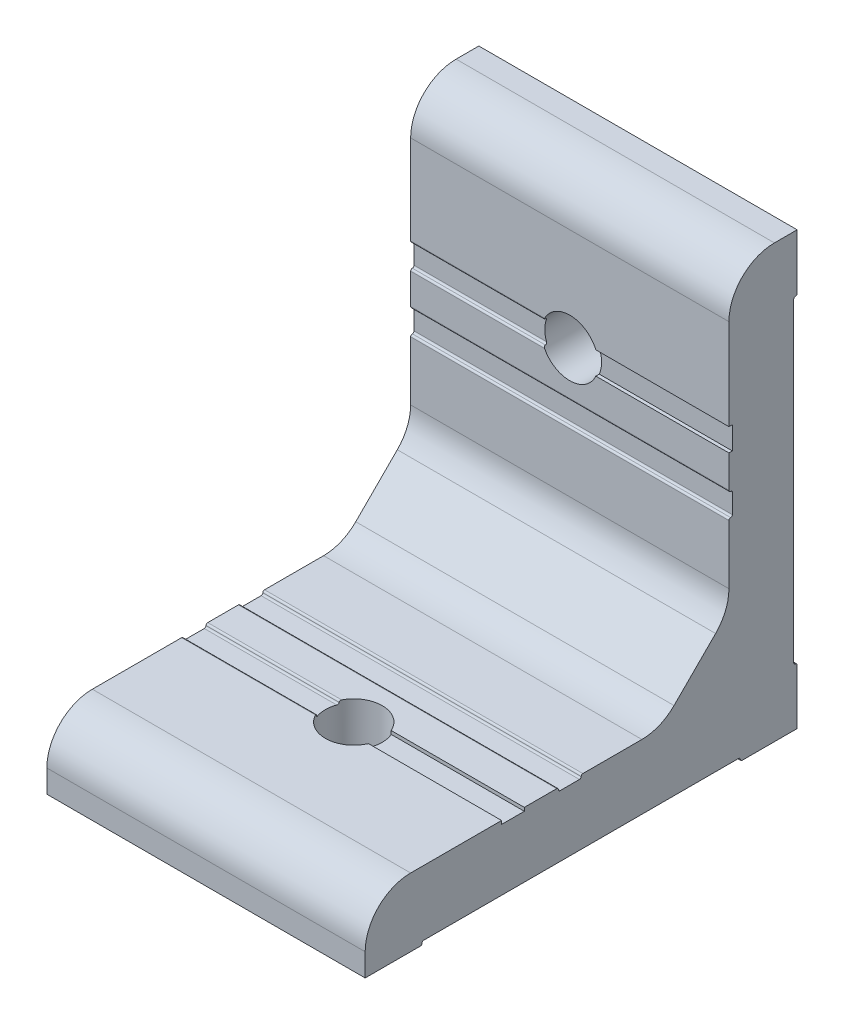
from build123d import *

# Parameters (mm, degrees)
ESBO_O1_W                  = 38
ESBO_O1_H                  = 38
RESSALTO_EXTRUS_O1_DEPTH   = 28
CORTE_EXTRUS_O1_DEPTH      = 57.471231614
ESBO_O7_W                  = 0.3
ESBO_O7_H                  = 28
ESBO_O7_W_2                = 28
ESBO_O7_H_2                = 0.3
ESBO_O7_W_3                = 2
ESBO_O7_H_3                = 2
CORTE_EXTRUS_O2_DEPTH      = 57.471231614
FURO_DE_DI_METRO_7_0_7_3_D = 5
FURO_DE_DI_METRO_7_0_7_2_D = 5
FILETE1_R                  = 4
FILETE2_R                  = 0.15


with BuildPart() as part:
    # Esboço1 → Ressalto-extrusão1 (new body)
    with BuildSketch(Plane(origin=(10, 0, 0), x_dir=(0, 0, -1), z_dir=(1, 0, 0))):
        with Locations((-12, 19)):
            Rectangle(ESBO_O1_W, ESBO_O1_H)
    extrude(amount=-RESSALTO_EXTRUS_O1_DEPTH)

    # Esboço2 → Corte-extrusão1 (cut, through all)
    with BuildSketch(Plane.ZY.offset(18)):
        Polygon((31, 38), (-1, 38), (-1, 12), (5, 6), (31, 6), align=None)
    extrude(amount=-CORTE_EXTRUS_O1_DEPTH, mode=Mode.SUBTRACT)

    # Esboço7 → Corte-extrusão2 (cut, through all)
    with BuildSketch(Plane(origin=(10, 0, 0), x_dir=(0, 0, -1), z_dir=(1, 0, 0))):
        with Locations((6.85, 19)):
            Rectangle(ESBO_O7_W, ESBO_O7_H)
        with Locations((-12, 0.15)):
            Rectangle(ESBO_O7_W_2, ESBO_O7_H_2)
        with Locations((-13, 5.85)):
            Rectangle(ESBO_O7_W_3, ESBO_O7_H_2)
        with Locations((1.15, 20)):
            Rectangle(ESBO_O7_W, ESBO_O7_H_3)
        with Locations((-18, 5.85)):
            Rectangle(ESBO_O7_W_3, ESBO_O7_H_2)
        with Locations((1.15, 25)):
            Rectangle(ESBO_O7_W, ESBO_O7_H_3)
    extrude(amount=-CORTE_EXTRUS_O2_DEPTH, mode=Mode.SUBTRACT)

    # Furo de diâmetro Ø7.0 (7)3 (through all)
    with Locations(Plane(origin=(0, 6, 0), x_dir=(1, 0, 0), z_dir=(0, 1, 0))):
        with Locations((-4, -18)):
            Hole(FURO_DE_DI_METRO_7_0_7_3_D / 2)

    # Furo de diâmetro Ø7.0 (7)2 (through all)
    with Locations(Plane(origin=(0, 0, -7), x_dir=(-1, 0, 0), z_dir=(0, 0, -1))):
        with Locations((4, 25)):
            Hole(FURO_DE_DI_METRO_7_0_7_2_D / 2)

    # Filete1
    filete1_edges = [part.edges().sort_by_distance(p)[0] for p in [
        (-4, 6, 31),
        (-4, 6, 5),
        (-4, 12, -1),
        (-4, 38, -1),
    ]]
    fillet(filete1_edges, radius=FILETE1_R)

    # Filete2
    filete2_edges = [part.edges().sort_by_distance(p)[0] for p in [
        (-4, 5, -7),
        (-4, 5, -6.7),
        (-4, 33, -7),
        (-4, 33, -6.7),
        (-4, 0, 26),
        (-4, 0.3, 26),
        (-4, 0.3, -2),
        (-4, 0, -2),
        (-4, 19, -1.3),
        (-4, 19, -1),
        (-4, 21, -1.3),
        (-4, 21, -1),
        (-4, 5.7, 14),
        (-4, 6, 14),
        (-4, 5.7, 12),
        (-4, 6, 12),
        (-12.145643924, 26, -1.3),
        (-12.145643924, 24, -1.3),
        (-12.145643924, 24, -1),
        (-12.145643924, 26, -1),
        (-12.145643924, 5.7, 19),
        (-12.145643924, 5.7, 17),
        (-12.145643924, 6, 17),
        (-12.145643924, 6, 19),
    ]]
    fillet(filete2_edges, radius=FILETE2_R - 0.0001)  # a hair under: the kernel refuses the full size


solid = part.part
